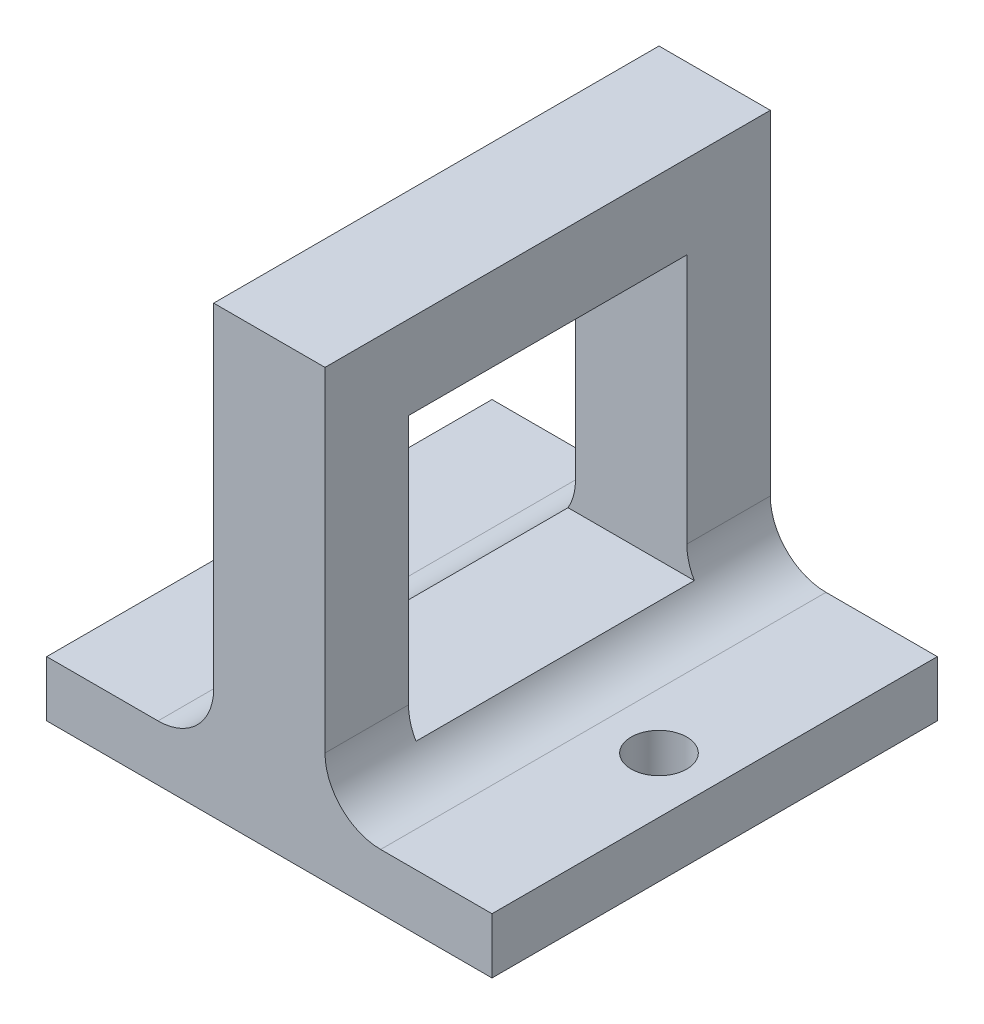
from build123d import *

# Parameters (mm, degrees)
SKETCH1_W           = 50.8
SKETCH1_H           = 50.8
SKETCH1_W_2         = 31.75
SKETCH1_H_2         = 31.75
BOSS_EXTRUDE1_DEPTH = 6.35
SKETCH2_W           = 50.8
SKETCH2_H           = 6.35
BOSS_EXTRUDE2_DEPTH = 25.4
FILLET1_R           = 6.35
SKETCH3_R           = 3.175
CUT_EXTRUDE1_DEPTH  = 58.15


with BuildPart() as part:
    # Sketch1 → Boss-Extrude1 (new, symmetric)
    with BuildSketch(Plane(origin=(0, 0, 0), x_dir=(0, 0, -1), z_dir=(1, 0, 0))):
        Rectangle(SKETCH1_W, SKETCH1_H)
        Rectangle(SKETCH1_W_2, SKETCH1_H_2, mode=Mode.SUBTRACT)
    extrude(amount=BOSS_EXTRUDE1_DEPTH, both=True)

    # Sketch2 → Boss-Extrude2 (add, symmetric)
    with BuildSketch(Plane(origin=(0, 0, 0), x_dir=(0, 0, -1), z_dir=(1, 0, 0))):
        with Locations((0, -22.225)):
            Rectangle(SKETCH2_W, SKETCH2_H)
    extrude(amount=BOSS_EXTRUDE2_DEPTH, both=True)

    # Fillet1
    # the kernel refuses this fillet: 6.35 mm, written as the material it adds along each edge
    with BuildSketch(Plane(origin=(-6.35, -19.05, -25.4), x_dir=(0, 1, 0), z_dir=(0, 0, 1))) as fillet1_piece_1_section:
        with BuildLine():
            CenterArc((FILLET1_R, FILLET1_R), FILLET1_R, 180, 90)
            Line((0, FILLET1_R), (0, 0))
            Line((0, 0), (FILLET1_R, 0))
        make_face()
    fillet1_piece_1 = extrude(amount=50.8, mode=Mode.PRIVATE)
    fillet1_piece_1 = split(fillet1_piece_1, bisect_by=Plane(origin=(-6.502453224, -14.838357518, -15.875), z_dir=(0, 0, -1)), keep=Keep.TOP, mode=Mode.PRIVATE)
    fillet1_piece_1 = split(fillet1_piece_1, bisect_by=Plane(origin=(-6.502453224, -15.875, -20.6375), z_dir=(0, 1, 0)), keep=Keep.TOP, mode=Mode.PRIVATE)
    add(fillet1_piece_1)
    with BuildSketch(Plane(origin=(-6.35, -19.05, -25.4), x_dir=(0, 1, 0), z_dir=(0, 0, 1))) as fillet1_piece_2_section:
        with BuildLine():
            CenterArc((FILLET1_R, FILLET1_R), FILLET1_R, 180, 90)
            Line((0, FILLET1_R), (0, 0))
            Line((0, 0), (FILLET1_R, 0))
        make_face()
    fillet1_piece_2 = extrude(amount=50.8, mode=Mode.PRIVATE)
    fillet1_piece_2 = split(fillet1_piece_2, bisect_by=Plane(origin=(-7.970012381, -18.006112297, -15.875), z_dir=(0, 0, -1)), keep=Keep.TOP, mode=Mode.PRIVATE)
    fillet1_piece_2 = split(fillet1_piece_2, bisect_by=Plane(origin=(-7.970012381, -15.875, -20.6375), z_dir=(0, -1, 0)), keep=Keep.TOP, mode=Mode.PRIVATE)
    add(fillet1_piece_2)
    with BuildSketch(Plane(origin=(-6.35, -19.05, -25.4), x_dir=(0, 1, 0), z_dir=(0, 0, 1))) as fillet1_piece_3_section:
        with BuildLine():
            CenterArc((FILLET1_R, FILLET1_R), FILLET1_R, 180, 90)
            Line((0, FILLET1_R), (0, 0))
            Line((0, 0), (FILLET1_R, 0))
        make_face()
    fillet1_piece_3 = extrude(amount=50.8, mode=Mode.PRIVATE)
    fillet1_piece_3 = split(fillet1_piece_3, bisect_by=Plane(origin=(-7.970012381, -18.006112297, -15.875), z_dir=(0, 0, 1)), keep=Keep.TOP, mode=Mode.PRIVATE)
    fillet1_piece_3 = split(fillet1_piece_3, bisect_by=Plane(origin=(-7.970012381, -15.875, 0), z_dir=(0, -1, 0)), keep=Keep.TOP, mode=Mode.PRIVATE)
    fillet1_piece_3 = split(fillet1_piece_3, bisect_by=Plane(origin=(-7.970012381, -18.006112297, 15.875), z_dir=(0, 0, -1)), keep=Keep.TOP, mode=Mode.PRIVATE)
    add(fillet1_piece_3)
    with BuildSketch(Plane(origin=(-6.35, -19.05, -25.4), x_dir=(0, 1, 0), z_dir=(0, 0, 1))) as fillet1_piece_4_section:
        with BuildLine():
            CenterArc((FILLET1_R, FILLET1_R), FILLET1_R, 180, 90)
            Line((0, FILLET1_R), (0, 0))
            Line((0, 0), (FILLET1_R, 0))
        make_face()
    fillet1_piece_4 = extrude(amount=50.8, mode=Mode.PRIVATE)
    fillet1_piece_4 = split(fillet1_piece_4, bisect_by=Plane(origin=(-6.502453224, -15.875, 20.6375), z_dir=(0, 1, 0)), keep=Keep.TOP, mode=Mode.PRIVATE)
    fillet1_piece_4 = split(fillet1_piece_4, bisect_by=Plane(origin=(-6.502453224, -14.838357518, 15.875), z_dir=(0, 0, 1)), keep=Keep.TOP, mode=Mode.PRIVATE)
    add(fillet1_piece_4)
    with BuildSketch(Plane(origin=(-6.35, -19.05, -25.4), x_dir=(0, 1, 0), z_dir=(0, 0, 1))) as fillet1_piece_5_section:
        with BuildLine():
            CenterArc((FILLET1_R, FILLET1_R), FILLET1_R, 180, 90)
            Line((0, FILLET1_R), (0, 0))
            Line((0, 0), (FILLET1_R, 0))
        make_face()
    fillet1_piece_5 = extrude(amount=50.8, mode=Mode.PRIVATE)
    fillet1_piece_5 = split(fillet1_piece_5, bisect_by=Plane(origin=(-7.970012381, -15.875, 20.6375), z_dir=(0, -1, 0)), keep=Keep.TOP, mode=Mode.PRIVATE)
    fillet1_piece_5 = split(fillet1_piece_5, bisect_by=Plane(origin=(-7.970012381, -18.006112297, 15.875), z_dir=(0, 0, 1)), keep=Keep.TOP, mode=Mode.PRIVATE)
    add(fillet1_piece_5)
    with BuildSketch(Plane(origin=(6.35, -19.05, -25.4), x_dir=(1, 0, 0), z_dir=(0, 0, 1))) as fillet1_piece_6_section:
        with BuildLine():
            CenterArc((FILLET1_R, FILLET1_R), FILLET1_R, 180, 90)
            Line((0, FILLET1_R), (0, 0))
            Line((0, 0), (FILLET1_R, 0))
        make_face()
    fillet1_piece_6 = extrude(amount=50.8, mode=Mode.PRIVATE)
    fillet1_piece_6 = split(fillet1_piece_6, bisect_by=Plane(origin=(7.970012381, -15.875, -20.6375), z_dir=(0, -1, 0)), keep=Keep.TOP, mode=Mode.PRIVATE)
    fillet1_piece_6 = split(fillet1_piece_6, bisect_by=Plane(origin=(7.970012381, -18.006112297, -15.875), z_dir=(0, 0, -1)), keep=Keep.TOP, mode=Mode.PRIVATE)
    add(fillet1_piece_6)
    with BuildSketch(Plane(origin=(6.35, -19.05, -25.4), x_dir=(1, 0, 0), z_dir=(0, 0, 1))) as fillet1_piece_7_section:
        with BuildLine():
            CenterArc((FILLET1_R, FILLET1_R), FILLET1_R, 180, 90)
            Line((0, FILLET1_R), (0, 0))
            Line((0, 0), (FILLET1_R, 0))
        make_face()
    fillet1_piece_7 = extrude(amount=50.8, mode=Mode.PRIVATE)
    fillet1_piece_7 = split(fillet1_piece_7, bisect_by=Plane(origin=(6.502453224, -15.875, -20.6375), z_dir=(0, 1, 0)), keep=Keep.TOP, mode=Mode.PRIVATE)
    fillet1_piece_7 = split(fillet1_piece_7, bisect_by=Plane(origin=(6.502453224, -14.838357518, -15.875), z_dir=(0, 0, -1)), keep=Keep.TOP, mode=Mode.PRIVATE)
    add(fillet1_piece_7)
    with BuildSketch(Plane(origin=(6.35, -19.05, -25.4), x_dir=(1, 0, 0), z_dir=(0, 0, 1))) as fillet1_piece_8_section:
        with BuildLine():
            CenterArc((FILLET1_R, FILLET1_R), FILLET1_R, 180, 90)
            Line((0, FILLET1_R), (0, 0))
            Line((0, 0), (FILLET1_R, 0))
        make_face()
    fillet1_piece_8 = extrude(amount=50.8, mode=Mode.PRIVATE)
    fillet1_piece_8 = split(fillet1_piece_8, bisect_by=Plane(origin=(7.970012381, -18.006112297, 15.875), z_dir=(0, 0, -1)), keep=Keep.TOP, mode=Mode.PRIVATE)
    fillet1_piece_8 = split(fillet1_piece_8, bisect_by=Plane(origin=(7.970012381, -15.875, 0), z_dir=(0, -1, 0)), keep=Keep.TOP, mode=Mode.PRIVATE)
    fillet1_piece_8 = split(fillet1_piece_8, bisect_by=Plane(origin=(7.970012381, -18.006112297, -15.875), z_dir=(0, 0, 1)), keep=Keep.TOP, mode=Mode.PRIVATE)
    add(fillet1_piece_8)
    with BuildSketch(Plane(origin=(6.35, -19.05, -25.4), x_dir=(1, 0, 0), z_dir=(0, 0, 1))) as fillet1_piece_9_section:
        with BuildLine():
            CenterArc((FILLET1_R, FILLET1_R), FILLET1_R, 180, 90)
            Line((0, FILLET1_R), (0, 0))
            Line((0, 0), (FILLET1_R, 0))
        make_face()
    fillet1_piece_9 = extrude(amount=50.8, mode=Mode.PRIVATE)
    fillet1_piece_9 = split(fillet1_piece_9, bisect_by=Plane(origin=(7.970012381, -18.006112297, 15.875), z_dir=(0, 0, 1)), keep=Keep.TOP, mode=Mode.PRIVATE)
    fillet1_piece_9 = split(fillet1_piece_9, bisect_by=Plane(origin=(7.970012381, -15.875, 20.6375), z_dir=(0, -1, 0)), keep=Keep.TOP, mode=Mode.PRIVATE)
    add(fillet1_piece_9)
    with BuildSketch(Plane(origin=(6.35, -19.05, -25.4), x_dir=(1, 0, 0), z_dir=(0, 0, 1))) as fillet1_piece_10_section:
        with BuildLine():
            CenterArc((FILLET1_R, FILLET1_R), FILLET1_R, 180, 90)
            Line((0, FILLET1_R), (0, 0))
            Line((0, 0), (FILLET1_R, 0))
        make_face()
    fillet1_piece_10 = extrude(amount=50.8, mode=Mode.PRIVATE)
    fillet1_piece_10 = split(fillet1_piece_10, bisect_by=Plane(origin=(6.502453224, -14.838357518, 15.875), z_dir=(0, 0, 1)), keep=Keep.TOP, mode=Mode.PRIVATE)
    fillet1_piece_10 = split(fillet1_piece_10, bisect_by=Plane(origin=(6.502453224, -15.875, 20.6375), z_dir=(0, 1, 0)), keep=Keep.TOP, mode=Mode.PRIVATE)
    add(fillet1_piece_10)

    # Sketch3 → Cut-Extrude1 (cut, through all)
    with BuildSketch(Plane(origin=(0, -19.05, 0), x_dir=(1, 0, 0), z_dir=(0, 1, 0))):
        with Locations(Location((19.05, 0, 0), (0, 0, 270))):
            Circle(SKETCH3_R)
    cut_extrude1 = extrude(amount=-CUT_EXTRUDE1_DEPTH, mode=Mode.SUBTRACT)

    # Mirror1: Cut-Extrude1 across plane
    add(cut_extrude1.mirror(Plane(origin=(0, 0, 0), x_dir=(0, 0, 1), z_dir=(1, 0, 0))), mode=Mode.SUBTRACT)


solid = part.part
